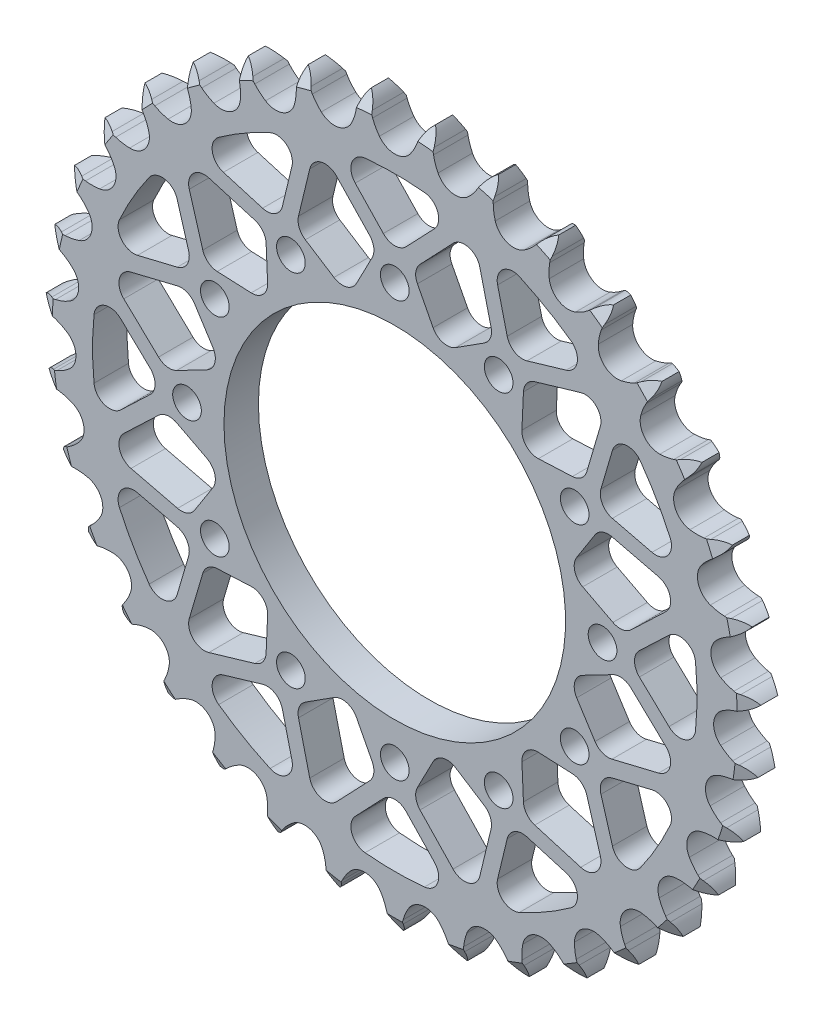
from build123d import *

# Parameters (mm, degrees)
EXTRUSION_DEPTH          = 7.2136
CUT_EXTRUDE_DEPTH        = 107.101930402
CUT_EXTRUDE_DEPTH_BACK   = 107.101930402
SKETCH1_R                = 35.764294032
F_6_0MM_DOWEL_HOLE1_D    = 6
CIRPATTERN1_COUNT        = 12
CUT_EXTRUDE2_DEPTH       = 107.101930402
FILLET2_R                = 3.302
CIRPATTERN3_COUNT        = 12
FILLET2_OF_CIRPATTERN3_R = 3.302


with BuildPart() as part:
    # Teeth Sketch → Extrusion (new body)
    with BuildSketch(Plane.XY):
        with BuildLine():
            ThreePointArc((6.71304247, 74.58801073), (5.721364967, 73.433815654), (5.028178681, 72.079163184))
            Line((5.028178681, 72.079163184), (4.640959349, 71.033174889))
            ThreePointArc((4.640959349, 71.033174889), (4.020032266, 69.686911282), (3.213588317, 68.442875791))
            ThreePointArc((3.213588317, 68.442875791), (0, 66.830622976), (-3.213588317, 68.442875791))
            ThreePointArc((-3.213588317, 68.442875791), (-4.020032266, 69.686911282), (-4.640959349, 71.033174889))
            Line((-4.640959349, 71.033174889), (-5.028178681, 72.079163184))
            ThreePointArc((-5.028178681, 72.079163184), (-5.721364967, 73.433815654), (-6.71304247, 74.58801073))
            ThreePointArc((-6.71304247, 74.58801073), (-7.482693818, 73.275293188), (-7.922857777, 71.81863735))
            Line((-7.922857777, 71.81863735), (-8.117085913, 70.720317836))
            ThreePointArc((-8.117085913, 70.720317836), (-8.487649793, 69.284818426), (-9.059002741, 67.91677897))
            ThreePointArc((-9.059002741, 67.91677897), (-11.933068516, 65.75662737), (-15.382892003, 66.769162268))
            ThreePointArc((-15.382892003, 66.769162268), (-16.39850718, 67.84920947), (-17.249840359, 69.062967255))
            Line((-17.249840359, 69.062967255), (-17.817605339, 70.023005406))
            ThreePointArc((-17.817605339, 70.023005406), (-18.741534375, 71.232114863), (-19.923364701, 72.190690694))
            ThreePointArc((-19.923364701, 72.190690694), (-20.446252667, 70.761642508), (-20.619247067, 69.249801418))
            Line((-20.619247067, 69.249801418), (-20.614241355, 68.134451579))
            ThreePointArc((-20.614241355, 68.134451579), (-20.722531804, 66.655854499), (-21.040429998, 65.207780992))
            ThreePointArc((-21.040429998, 65.207780992), (-23.482598391, 62.569159656), (-27.057776883, 62.949432932))
            ThreePointArc((-27.057776883, 62.949432932), (-28.249920581, 63.830778239), (-29.304297307, 64.873019029))
            Line((-29.304297307, 64.873019029), (-30.034359501, 65.716250619))
            ThreePointArc((-30.034359501, 65.716250619), (-31.159335447, 66.740955291), (-32.493333597, 67.473102461))
            ThreePointArc((-32.493333597, 67.473102461), (-32.752652133, 65.973654415), (-32.65291679, 64.455219891))
            Line((-32.65291679, 64.455219891), (-32.448838118, 63.358687986))
            ThreePointArc((-32.448838118, 63.358687986), (-32.291374592, 61.884516564), (-32.345600523, 60.402951279))
            ThreePointArc((-32.345600523, 60.402951279), (-34.277378233, 57.370667669), (-37.863002551, 57.106457027))
            ThreePointArc((-37.863002551, 57.106457027), (-39.19335829, 57.760773275), (-40.416890027, 58.597998593))
            Line((-40.416890027, 58.597998593), (-41.285784636, 59.297321467))
            ThreePointArc((-41.285784636, 59.297321467), (-42.57564984, 60.104686501), (-44.018940016, 60.586873197))
            ThreePointArc((-44.018940016, 60.586873197), (-44.006354409, 59.065218786), (-43.637094901, 57.588994562))
            Line((-43.637094901, 57.588994562), (-43.240502525, 56.54652403))
            ThreePointArc((-43.240502525, 56.54652403), (-42.822346032, 55.124159347), (-42.611156832, 53.656721012))
            ThreePointArc((-42.611156832, 53.656721012), (-43.970454934, 50.328235218), (-47.451280163, 49.428032606))
            ThreePointArc((-47.451280163, 49.428032606), (-48.877089215, 49.834289533), (-50.230450647, 50.439590267))
            Line((-50.230450647, 50.439590267), (-51.210250682, 50.972527612))
            ThreePointArc((-51.210250682, 50.972527612), (-52.623547816, 51.536603632), (-54.129741484, 51.753331977))
            ThreePointArc((-54.129741484, 51.753331977), (-53.845656247, 50.258378426), (-53.218740877, 48.871811564))
            Line((-53.218740877, 48.871811564), (-52.642381603, 47.916908265))
            ThreePointArc((-52.642381603, 47.916908265), (-51.976972035, 46.592066293), (-51.507155501, 45.185919584))
            ThreePointArc((-51.507155501, 45.185919584), (-52.250285035, 41.668211877), (-55.514434587, 40.160950547))
            ThreePointArc((-55.514434587, 40.160950547), (-56.989870277, 40.306090721), (-58.429563253, 40.660012009))
            Line((-58.429563253, 40.660012009), (-59.488777136, 41.009434779))
            ThreePointArc((-59.488777136, 41.009434779), (-60.980081666, 41.312091918), (-62.500768523, 41.256396085))
            ThreePointArc((-62.500768523, 41.256396085), (-61.954314388, 39.83619243), (-61.089892733, 38.58384833))
            Line((-61.089892733, 38.58384833), (-60.352291222, 37.747203643))
            ThreePointArc((-60.352291222, 37.747203643), (-59.461015391, 36.562465892), (-58.747671811, 35.26280552))
            ThreePointArc((-58.747671811, 35.26280552), (-58.850747983, 31.668937922), (-61.793309406, 29.603062493))
            ThreePointArc((-61.793309406, 29.603062493), (-63.270950016, 29.48242099), (-64.750701621, 29.573587509))
            Line((-64.750701621, 29.573587509), (-65.855285346, 29.72826497))
            ThreePointArc((-65.855285346, 29.72826497), (-67.376665517, 29.759775578), (-68.862969436, 29.433445677))
            ThreePointArc((-68.862969436, 29.433445677), (-68.071709889, 28.133638433), (-66.997565172, 27.055768464))
            Line((-66.997565172, 27.055768464), (-66.122428543, 26.364272836))
            ThreePointArc((-66.122428543, 26.364272836), (-65.033932787, 25.357717754), (-64.099989612, 24.206315873))
            ThreePointArc((-64.099989612, 24.206315873), (-63.559699469, 20.651798244), (-66.086096418, 18.093707653))
            ThreePointArc((-66.086096418, 18.093707653), (-67.518449363, 17.71116199), (-68.990699161, 17.536643574))
            Line((-68.990699161, 17.536643574), (-70.105150498, 17.491604264))
            ThreePointArc((-70.105150498, 17.491604264), (-71.6077079, 17.250955565), (-73.01185785, 16.664480107))
            ThreePointArc((-73.01185785, 16.664480107), (-72.001224624, 15.526846148), (-70.75188074, 14.658093938))
            Line((-70.75188074, 14.658093938), (-69.767336604, 14.133972608))
            ThreePointArc((-69.767336604, 14.133972608), (-68.516606073, 13.337951702), (-67.392081005, 12.371815317))
            ThreePointArc((-67.392081005, 12.371815317), (-66.225789916, 8.970892779), (-68.254821914, 6.002806162))
            ThreePointArc((-68.254821914, 6.002806162), (-69.595850193, 5.37065167), (-71.013278864, 4.936057485))
            Line((-71.013278864, 4.936057485), (-72.101778431, 4.692749005))
            ThreePointArc((-72.101778431, 4.692749005), (-73.537219633, 4.187675646), (-74.814085078, 3.359904435))
            ThreePointArc((-74.814085078, 3.359904435), (-73.616560757, 2.421008252), (-72.232172646, 1.789296212))
            Line((-72.232172646, 1.789296212), (-71.169865063, 1.449394871))
            ThreePointArc((-71.169865063, 1.449394871), (-69.797099265, 0.889492908), (-68.518135464, 0.139674437))
            ThreePointArc((-68.518135464, 0.139674437), (-66.763328985, -2.998344562), (-68.229781274, -6.281030459))
            ThreePointArc((-68.229781274, -6.281030459), (-69.436383134, -7.142475813), (-70.753433355, -7.823177553))
            Line((-70.753433355, -7.823177553), (-71.780995879, -8.256935068))
            ThreePointArc((-71.780995879, -8.256935068), (-73.10318462, -9.010199614), (-74.211726055, -10.05266133))
            ThreePointArc((-74.211726055, -10.05266133), (-72.865800055, -10.762642841), (-71.390863091, -11.137010967))
            Line((-71.390863091, -11.137010967), (-70.284935499, -11.281767609))
            ThreePointArc((-70.284935499, -11.281767609), (-68.834256257, -11.587554919), (-67.441960672, -12.096955695))
            ThreePointArc((-67.441960672, -12.096955695), (-65.155039727, -14.871212641), (-66.011779325, -18.362989592))
            ThreePointArc((-66.011779325, -18.362989592), (-67.045173588, -19.426038247), (-68.219514282, -20.330969227))
            Line((-68.219514282, -20.330969227), (-69.153113058, -20.941234454))
            ThreePointArc((-69.153113058, -20.941234454), (-70.319553103, -21.918479645), (-71.224141095, -23.142126289))
            ThreePointArc((-71.224141095, -23.142126289), (-69.773072586, -23.600373738), (-68.254992455, -23.705365449))
            Line((-68.254992455, -23.705365449), (-67.140990279, -23.650324796))
            ThreePointArc((-67.140990279, -23.650324796), (-65.659023615, -23.692169198), (-64.198145773, -23.944779717))
            ThreePointArc((-64.198145773, -23.944779717), (-61.452613883, -26.26610771), (-61.672104473, -29.854747131))
            ThreePointArc((-61.672104473, -29.854747131), (-62.499076998, -31.085231827), (-63.492963888, -32.185306822))
            Line((-63.492963888, -32.185306822), (-64.302592284, -32.952465334))
            ThreePointArc((-64.302592284, -32.952465334), (-65.275793291, -34.122281706), (-65.947353637, -35.487784268))
            ThreePointArc((-65.947353637, -35.487784268), (-64.437781154, -35.679569204), (-62.925350201, -35.511809981))
            Line((-62.925350201, -35.511809981), (-61.839078386, -35.258741085))
            ThreePointArc((-61.839078386, -35.258741085), (-60.373455931, -35.035297664), (-58.890949646, -35.022998817))
            ThreePointArc((-58.890949646, -35.022998817), (-55.775050465, -36.816788466), (-55.350237439, -40.386948533))
            ThreePointArc((-55.350237439, -40.386948533), (-55.94420865, -41.74532048), (-56.725697393, -43.005182174))
            Line((-56.725697393, -43.005182174), (-57.385333286, -43.904576866))
            ThreePointArc((-57.385333286, -43.904576866), (-58.134015774, -45.229365557), (-58.550963971, -46.69283566))
            ThreePointArc((-58.550963971, -46.69283566), (-57.031406416, -46.611993959), (-55.573235417, -46.176875721))
            Line((-55.573235417, -46.176875721), (-54.549607633, -45.733912424))
            ThreePointArc((-54.549607633, -45.733912424), (-53.147435697, -45.252362836), (-51.690949942, -44.975549918))
            ThreePointArc((-51.690949942, -44.975549918), (-48.304831033, -46.184147347), (-47.249368232, -49.621080178))
            ThreePointArc((-47.249368232, -49.621080178), (-47.591247404, -51.063680184), (-48.13522031, -52.442835586))
            Line((-48.13522031, -52.442835586), (-48.623662459, -53.445559171))
            ThreePointArc((-48.623662459, -53.445559171), (-49.123763156, -54.882740383), (-49.272698147, -56.397140896))
            ThreePointArc((-49.272698147, -56.397140896), (-47.79199535, -56.046270876), (-46.434951121, -55.357778681))
            Line((-46.434951121, -55.357778681), (-45.506867607, -54.739158188))
            ThreePointArc((-45.506867607, -54.739158188), (-44.21321315, -54.014979833), (-42.829560576, -53.482549839))
            ThreePointArc((-42.829560576, -53.482549839), (-39.282054587, -54.067109732), (-37.629865453, -57.260349478))
            ThreePointArc((-37.629865453, -57.260349478), (-37.708664308, -58.740811192), (-37.99763764, -60.194933112))
            Line((-37.99763764, -60.194933112), (-38.299187113, -61.26875723))
            ThreePointArc((-38.299187113, -61.26875723), (-38.534632372, -62.772138777), (-38.410767263, -64.288795619))
            ThreePointArc((-38.410767263, -64.288795619), (-37.016510231, -63.679174531), (-35.804209288, -62.759437086))
            Line((-35.804209288, -62.759437086), (-35.001499413, -61.985042368))
            ThreePointArc((-35.001499413, -61.985042368), (-33.857941554, -61.041510934), (-32.591593892, -60.270576602))
            ThreePointArc((-32.591593892, -60.270576602), (-28.996720584, -60.212310724), (-26.800907836, -63.059224032))
            ThreePointArc((-26.800907836, -63.059224032), (-26.614093715, -64.529964196), (-26.638779631, -66.012315959))
            Line((-26.638779631, -66.012315959), (-26.743744381, -67.12272702))
            ThreePointArc((-26.743744381, -67.12272702), (-26.706966797, -68.643988981), (-26.314282715, -70.114155555))
            ThreePointArc((-26.314282715, -70.114155555), (-25.051284015, -69.265377122), (-24.02269071, -68.143955544))
            Line((-24.02269071, -68.143955544), (-23.371154229, -67.238676285))
            ThreePointArc((-23.371154229, -67.238676285), (-22.414447858, -66.106117649), (-21.306106564, -65.121457443))
            ThreePointArc((-21.306106564, -65.121457443), (-17.779408124, -64.422238506), (-15.110546989, -66.83132324))
            ThreePointArc((-15.110546989, -66.83132324), (-14.664124252, -68.245071055), (-14.423729327, -69.708008656))
            Line((-14.423729327, -69.708008656), (-14.328735699, -70.819317134))
            ThreePointArc((-14.328735699, -70.819317134), (-14.020917334, -72.309564898), (-13.372035469, -73.68598884))
            ThreePointArc((-13.372035469, -73.68598884), (-12.280888919, -72.6253335), (-11.469063086, -71.338271201))
            Line((-11.469063086, -71.338271201), (-10.989640918, -70.331203822))
            ThreePointArc((-10.989640918, -70.331203822), (-10.250535365, -69.04601935), (-9.335823441, -67.879281059))
            ThreePointArc((-9.335823441, -67.879281059), (-5.990650857, -66.561582535), (-2.93452073, -68.455408731))
            ThreePointArc((-2.93452073, -68.455408731), (-2.242837769, -69.766725179), (-1.745088495, -71.163228599))
            Line((-1.745088495, -71.163228599), (-1.453189662, -72.239716126))
            ThreePointArc((-1.453189662, -72.239716126), (-0.884224052, -73.651051903), (0, -74.889493815))
            ThreePointArc((0, -74.889493815), (0.884224052, -73.651051903), (1.453189662, -72.239716126))
            Line((1.453189662, -72.239716126), (1.745088495, -71.163228599))
            ThreePointArc((1.745088495, -71.163228599), (2.242837769, -69.766725179), (2.93452073, -68.455408731))
            ThreePointArc((2.93452073, -68.455408731), (5.990650857, -66.561582535), (9.335823441, -67.879281059))
            ThreePointArc((9.335823441, -67.879281059), (10.250535365, -69.04601935), (10.989640918, -70.331203822))
            Line((10.989640918, -70.331203822), (11.469063086, -71.338271201))
            ThreePointArc((11.469063086, -71.338271201), (12.280888919, -72.6253335), (13.372035469, -73.68598884))
            ThreePointArc((13.372035469, -73.68598884), (14.020917334, -72.309564898), (14.328735699, -70.819317134))
            Line((14.328735699, -70.819317134), (14.423729327, -69.708008656))
            ThreePointArc((14.423729327, -69.708008656), (14.664124252, -68.245071055), (15.110546989, -66.83132324))
            ThreePointArc((15.110546989, -66.83132324), (17.779408124, -64.422238506), (21.306106564, -65.121457443))
            ThreePointArc((21.306106564, -65.121457443), (22.414447858, -66.106117649), (23.371154229, -67.238676285))
            Line((23.371154229, -67.238676285), (24.02269071, -68.143955544))
            ThreePointArc((24.02269071, -68.143955544), (25.051284015, -69.265377122), (26.314282715, -70.114155555))
            ThreePointArc((26.314282715, -70.114155555), (26.706966797, -68.643988981), (26.743744381, -67.12272702))
            Line((26.743744381, -67.12272702), (26.638779631, -66.012315959))
            ThreePointArc((26.638779631, -66.012315959), (26.614093715, -64.529964196), (26.800907836, -63.059224032))
            ThreePointArc((26.800907836, -63.059224032), (28.996720584, -60.212310724), (32.591593892, -60.270576602))
            ThreePointArc((32.591593892, -60.270576602), (33.857941554, -61.041510934), (35.001499413, -61.985042368))
            Line((35.001499413, -61.985042368), (35.804209288, -62.759437086))
            ThreePointArc((35.804209288, -62.759437086), (37.016510231, -63.679174531), (38.410767263, -64.288795619))
            ThreePointArc((38.410767263, -64.288795619), (38.534632372, -62.772138777), (38.299187113, -61.26875723))
            Line((38.299187113, -61.26875723), (37.99763764, -60.194933112))
            ThreePointArc((37.99763764, -60.194933112), (37.708664308, -58.740811192), (37.629865453, -57.260349478))
            ThreePointArc((37.629865453, -57.260349478), (39.282054587, -54.067109732), (42.829560576, -53.482549839))
            ThreePointArc((42.829560576, -53.482549839), (44.21321315, -54.014979833), (45.506867607, -54.739158188))
            Line((45.506867607, -54.739158188), (46.434951121, -55.357778681))
            ThreePointArc((46.434951121, -55.357778681), (47.79199535, -56.046270876), (49.272698147, -56.397140896))
            ThreePointArc((49.272698147, -56.397140896), (49.123763156, -54.882740383), (48.623662459, -53.445559171))
            Line((48.623662459, -53.445559171), (48.13522031, -52.442835586))
            ThreePointArc((48.13522031, -52.442835586), (47.591247404, -51.063680184), (47.249368232, -49.621080178))
            ThreePointArc((47.249368232, -49.621080178), (48.304831033, -46.184147347), (51.690949942, -44.975549918))
            ThreePointArc((51.690949942, -44.975549918), (53.147435697, -45.252362836), (54.549607633, -45.733912424))
            Line((54.549607633, -45.733912424), (55.573235417, -46.176875721))
            ThreePointArc((55.573235417, -46.176875721), (57.031406416, -46.611993959), (58.550963971, -46.69283566))
            ThreePointArc((58.550963971, -46.69283566), (58.134015774, -45.229365557), (57.385333286, -43.904576866))
            Line((57.385333286, -43.904576866), (56.725697393, -43.005182174))
            ThreePointArc((56.725697393, -43.005182174), (55.94420865, -41.74532048), (55.350237439, -40.386948533))
            ThreePointArc((55.350237439, -40.386948533), (55.775050465, -36.816788466), (58.890949646, -35.022998817))
            ThreePointArc((58.890949646, -35.022998817), (60.373455931, -35.035297664), (61.839078386, -35.258741085))
            Line((61.839078386, -35.258741085), (62.925350201, -35.511809981))
            ThreePointArc((62.925350201, -35.511809981), (64.437781154, -35.679569204), (65.947353637, -35.487784268))
            ThreePointArc((65.947353637, -35.487784268), (65.275793291, -34.122281706), (64.302592284, -32.952465334))
            Line((64.302592284, -32.952465334), (63.492963888, -32.185306822))
            ThreePointArc((63.492963888, -32.185306822), (62.499076998, -31.085231827), (61.672104473, -29.854747131))
            ThreePointArc((61.672104473, -29.854747131), (61.452613883, -26.26610771), (64.198145773, -23.944779717))
            ThreePointArc((64.198145773, -23.944779717), (65.659023615, -23.692169198), (67.140990279, -23.650324796))
            Line((67.140990279, -23.650324796), (68.254992455, -23.705365449))
            ThreePointArc((68.254992455, -23.705365449), (69.773072586, -23.600373738), (71.224141095, -23.142126289))
            ThreePointArc((71.224141095, -23.142126289), (70.319553103, -21.918479645), (69.153113058, -20.941234454))
            Line((69.153113058, -20.941234454), (68.219514282, -20.330969227))
            ThreePointArc((68.219514282, -20.330969227), (67.045173588, -19.426038247), (66.011779325, -18.362989592))
            ThreePointArc((66.011779325, -18.362989592), (65.155039727, -14.871212641), (67.441960672, -12.096955695))
            ThreePointArc((67.441960672, -12.096955695), (68.834256257, -11.587554919), (70.284935499, -11.281767609))
            Line((70.284935499, -11.281767609), (71.390863091, -11.137010967))
            ThreePointArc((71.390863091, -11.137010967), (72.865800055, -10.762642841), (74.211726055, -10.05266133))
            ThreePointArc((74.211726055, -10.05266133), (73.10318462, -9.010199614), (71.780995879, -8.256935068))
            Line((71.780995879, -8.256935068), (70.753433355, -7.823177553))
            ThreePointArc((70.753433355, -7.823177553), (69.436383134, -7.142475813), (68.229781274, -6.281030459))
            ThreePointArc((68.229781274, -6.281030459), (66.763328985, -2.998344562), (68.518135464, 0.139674437))
            ThreePointArc((68.518135464, 0.139674437), (69.797099265, 0.889492908), (71.169865063, 1.449394871))
            Line((71.169865063, 1.449394871), (72.232172646, 1.789296212))
            ThreePointArc((72.232172646, 1.789296212), (73.616560757, 2.421008252), (74.814085078, 3.359904435))
            ThreePointArc((74.814085078, 3.359904435), (73.537219633, 4.187675646), (72.101778431, 4.692749005))
            Line((72.101778431, 4.692749005), (71.013278864, 4.936057485))
            ThreePointArc((71.013278864, 4.936057485), (69.595850193, 5.37065167), (68.254821914, 6.002806162))
            ThreePointArc((68.254821914, 6.002806162), (66.225789916, 8.970892779), (67.392081005, 12.371815317))
            ThreePointArc((67.392081005, 12.371815317), (68.516606073, 13.337951702), (69.767336604, 14.133972608))
            Line((69.767336604, 14.133972608), (70.75188074, 14.658093938))
            ThreePointArc((70.75188074, 14.658093938), (72.001224624, 15.526846148), (73.01185785, 16.664480107))
            ThreePointArc((73.01185785, 16.664480107), (71.6077079, 17.250955565), (70.105150498, 17.491604264))
            Line((70.105150498, 17.491604264), (68.990699161, 17.536643574))
            ThreePointArc((68.990699161, 17.536643574), (67.518449363, 17.71116199), (66.086096418, 18.093707653))
            ThreePointArc((66.086096418, 18.093707653), (63.559699469, 20.651798244), (64.099989612, 24.206315873))
            ThreePointArc((64.099989612, 24.206315873), (65.033932787, 25.357717754), (66.122428543, 26.364272836))
            Line((66.122428543, 26.364272836), (66.997565172, 27.055768464))
            ThreePointArc((66.997565172, 27.055768464), (68.071709889, 28.133638433), (68.862969436, 29.433445677))
            ThreePointArc((68.862969436, 29.433445677), (67.376665517, 29.759775578), (65.855285346, 29.72826497))
            Line((65.855285346, 29.72826497), (64.750701621, 29.573587509))
            ThreePointArc((64.750701621, 29.573587509), (63.270950016, 29.48242099), (61.793309406, 29.603062493))
            ThreePointArc((61.793309406, 29.603062493), (58.850747983, 31.668937922), (58.747671811, 35.26280552))
            ThreePointArc((58.747671811, 35.26280552), (59.461015391, 36.562465892), (60.352291222, 37.747203643))
            Line((60.352291222, 37.747203643), (61.089892733, 38.58384833))
            ThreePointArc((61.089892733, 38.58384833), (61.954314388, 39.83619243), (62.500768523, 41.256396085))
            ThreePointArc((62.500768523, 41.256396085), (60.980081666, 41.312091918), (59.488777136, 41.009434779))
            Line((59.488777136, 41.009434779), (58.429563253, 40.660012009))
            ThreePointArc((58.429563253, 40.660012009), (56.989870277, 40.306090721), (55.514434587, 40.160950547))
            ThreePointArc((55.514434587, 40.160950547), (52.250285035, 41.668211877), (51.507155501, 45.185919584))
            ThreePointArc((51.507155501, 45.185919584), (51.976972035, 46.592066293), (52.642381603, 47.916908265))
            Line((52.642381603, 47.916908265), (53.218740877, 48.871811564))
            ThreePointArc((53.218740877, 48.871811564), (53.845656247, 50.258378426), (54.129741484, 51.753331977))
            ThreePointArc((54.129741484, 51.753331977), (52.623547816, 51.536603632), (51.210250682, 50.972527612))
            Line((51.210250682, 50.972527612), (50.230450647, 50.439590267))
            ThreePointArc((50.230450647, 50.439590267), (48.877089215, 49.834289533), (47.451280163, 49.428032606))
            ThreePointArc((47.451280163, 49.428032606), (43.970454934, 50.328235218), (42.611156832, 53.656721012))
            ThreePointArc((42.611156832, 53.656721012), (42.822346032, 55.124159347), (43.240502525, 56.54652403))
            Line((43.240502525, 56.54652403), (43.637094901, 57.588994562))
            ThreePointArc((43.637094901, 57.588994562), (44.006354409, 59.065218786), (44.018940016, 60.586873197))
            ThreePointArc((44.018940016, 60.586873197), (42.57564984, 60.104686501), (41.285784636, 59.297321467))
            Line((41.285784636, 59.297321467), (40.416890027, 58.597998593))
            ThreePointArc((40.416890027, 58.597998593), (39.19335829, 57.760773275), (37.863002551, 57.106457027))
            ThreePointArc((37.863002551, 57.106457027), (34.277378233, 57.370667669), (32.345600523, 60.402951279))
            ThreePointArc((32.345600523, 60.402951279), (32.291374592, 61.884516564), (32.448838118, 63.358687986))
            Line((32.448838118, 63.358687986), (32.65291679, 64.455219891))
            ThreePointArc((32.65291679, 64.455219891), (32.752652133, 65.973654415), (32.493333597, 67.473102461))
            ThreePointArc((32.493333597, 67.473102461), (31.159335447, 66.740955291), (30.034359501, 65.716250619))
            Line((30.034359501, 65.716250619), (29.304297307, 64.873019029))
            ThreePointArc((29.304297307, 64.873019029), (28.249920581, 63.830778239), (27.057776883, 62.949432932))
            ThreePointArc((27.057776883, 62.949432932), (23.482598391, 62.569159656), (21.040429998, 65.207780992))
            ThreePointArc((21.040429998, 65.207780992), (20.722531804, 66.655854499), (20.614241355, 68.134451579))
            Line((20.614241355, 68.134451579), (20.619247067, 69.249801418))
            ThreePointArc((20.619247067, 69.249801418), (20.446252667, 70.761642508), (19.923364701, 72.190690694))
            ThreePointArc((19.923364701, 72.190690694), (18.741534375, 71.232114863), (17.817605339, 70.023005406))
            Line((17.817605339, 70.023005406), (17.249840359, 69.062967255))
            ThreePointArc((17.249840359, 69.062967255), (16.39850718, 67.84920947), (15.382892003, 66.769162268))
            ThreePointArc((15.382892003, 66.769162268), (11.933068516, 65.75662737), (9.059002741, 67.91677897))
            ThreePointArc((9.059002741, 67.91677897), (8.487649793, 69.284818426), (8.117085913, 70.720317836))
            Line((8.117085913, 70.720317836), (7.922857777, 71.81863735))
            ThreePointArc((7.922857777, 71.81863735), (7.482693818, 73.275293188), (6.71304247, 74.58801073))
        make_face()
    extrude(amount=EXTRUSION_DEPTH)

    # Sketch1 → Cut-Extrude (cut, two sides: drawn at the far end of the back side and taken through both)
    with BuildSketch(Plane(origin=(0, 0, 0), x_dir=(-1, 0, 0), z_dir=(0, 0, -1)).offset(-CUT_EXTRUDE_DEPTH_BACK)):
        Circle(SKETCH1_R)
    extrude(amount=CUT_EXTRUDE_DEPTH + CUT_EXTRUDE_DEPTH_BACK, mode=Mode.SUBTRACT)

    # Ø6.0mm Dowel Hole1 (through all)
    with Locations(Plane.XY.offset(7.2136)):
        with Locations((-43.500000122, 0)):
            f_6_0mm_dowel_hole1 = Hole(F_6_0MM_DOWEL_HOLE1_D / 2)

    # CirPattern1: Ø6.0mm Dowel Hole1 ×12 about axis
    cirpattern1_axis = Axis((0, 0, 7.2136), (0, 0, -1))
    for i in range(1, CIRPATTERN1_COUNT):
        add(f_6_0mm_dowel_hole1.rotate(cirpattern1_axis, i * 360 / CIRPATTERN1_COUNT), mode=Mode.SUBTRACT)

    # Sketch9 → Cut-Extrude2 (cut, through all)
    with BuildSketch(Plane.XY):
        with BuildLine():
            Line((-48.707000122, 0), (-61.996550726, 12.653284584))
            ThreePointArc((-61.996550726, 12.653284584), (-63.274622976, 0), (-61.996550726, -12.653284584))
            Line((-61.996550726, -12.653284584), (-48.707000122, 0))
        make_face()
        Polygon((-43.188712268, 20.712736659), (-61.118592481, 16.376677498), (-47.75889031, 3.656600005), (-36.140398804, 9.683790674), align=None)
    cut_extrude2 = extrude(amount=CUT_EXTRUDE2_DEPTH, mode=Mode.SUBTRACT)

    # Fillet2
    fillet2_edges = [part.edges().sort_by_distance(p)[0] for p in [
        (-61.118592481, 16.376677498, 3.6068),
        (-36.140398804, 9.683790674, 3.6068),
        (-47.75889031, 3.656600005, 3.6068),
        (-43.188712268, 20.712736659, 3.6068),
        (-61.996550726, -12.653284584, 3.6068),
        (-48.707000122, 0, 3.6068),
        (-61.996550726, 12.653284584, 3.6068),
    ]]
    fillet(fillet2_edges, radius=FILLET2_R)

    # CirPattern3: Cut-Extrude2 ×12 about axis
    cirpattern3_axis = Axis((0, 0, 7.2136), (0, 0, -1))
    for i in range(1, CIRPATTERN3_COUNT):
        add(cut_extrude2.rotate(cirpattern3_axis, i * 360 / CIRPATTERN3_COUNT), mode=Mode.SUBTRACT)

    # Fillet2 of CirPattern3
    fillet2_of_cirpattern3_edges = [part.edges().sort_by_distance(p)[0] for p in [
        (-44.741914983, 44.741914983, 3.6068),
        (-26.45660813, 26.45660813, 3.6068),
        (-39.532112263, 27.046153651, 3.6068),
        (-27.046153651, 39.532112263, 3.6068),
        (-60.017230168, 20.040209472, 3.6068),
        (-42.181499448, 24.353500061, 3.6068),
        (-47.363945584, 41.956341254, 3.6068),
        (-16.376677498, 61.118592481, 3.6068),
        (-9.683790674, 36.140398804, 3.6068),
        (-20.712736659, 43.188712268, 3.6068),
        (-3.656600005, 47.75889031, 3.6068),
        (-41.956341254, 47.363945584, 3.6068),
        (-24.353500061, 42.181499448, 3.6068),
        (-20.040209472, 60.017230168, 3.6068),
        (16.376677498, 61.118592481, 3.6068),
        (9.683790674, 36.140398804, 3.6068),
        (3.656600005, 47.75889031, 3.6068),
        (20.712736659, 43.188712268, 3.6068),
        (-12.653284584, 61.996550726, 3.6068),
        (0, 48.707000122, 3.6068),
        (12.653284584, 61.996550726, 3.6068),
        (44.741914983, 44.741914983, 3.6068),
        (26.45660813, 26.45660813, 3.6068),
        (27.046153651, 39.532112263, 3.6068),
        (39.532112263, 27.046153651, 3.6068),
        (20.040209472, 60.017230168, 3.6068),
        (24.353500061, 42.181499448, 3.6068),
        (41.956341254, 47.363945584, 3.6068),
        (61.118592481, 16.376677498, 3.6068),
        (36.140398804, 9.683790674, 3.6068),
        (43.188712268, 20.712736659, 3.6068),
        (47.75889031, 3.656600005, 3.6068),
        (47.363945584, 41.956341254, 3.6068),
        (42.181499448, 24.353500061, 3.6068),
        (60.017230168, 20.040209472, 3.6068),
        (61.118592481, -16.376677498, 3.6068),
        (36.140398804, -9.683790674, 3.6068),
        (47.75889031, -3.656600005, 3.6068),
        (43.188712268, -20.712736659, 3.6068),
        (61.996550726, 12.653284584, 3.6068),
        (48.707000122, 0, 3.6068),
        (61.996550726, -12.653284584, 3.6068),
        (44.741914983, -44.741914983, 3.6068),
        (26.45660813, -26.45660813, 3.6068),
        (39.532112263, -27.046153651, 3.6068),
        (27.046153651, -39.532112263, 3.6068),
        (60.017230168, -20.040209472, 3.6068),
        (42.181499448, -24.353500061, 3.6068),
        (47.363945584, -41.956341254, 3.6068),
        (16.376677498, -61.118592481, 3.6068),
        (9.683790674, -36.140398804, 3.6068),
        (20.712736659, -43.188712268, 3.6068),
        (3.656600005, -47.75889031, 3.6068),
        (41.956341254, -47.363945584, 3.6068),
        (24.353500061, -42.181499448, 3.6068),
        (20.040209472, -60.017230168, 3.6068),
        (-16.376677498, -61.118592481, 3.6068),
        (-9.683790674, -36.140398804, 3.6068),
        (-3.656600005, -47.75889031, 3.6068),
        (-20.712736659, -43.188712268, 3.6068),
        (12.653284584, -61.996550726, 3.6068),
        (0, -48.707000122, 3.6068),
        (-12.653284584, -61.996550726, 3.6068),
        (-44.741914983, -44.741914983, 3.6068),
        (-26.45660813, -26.45660813, 3.6068),
        (-27.046153651, -39.532112263, 3.6068),
        (-39.532112263, -27.046153651, 3.6068),
        (-20.040209472, -60.017230168, 3.6068),
        (-24.353500061, -42.181499448, 3.6068),
        (-41.956341254, -47.363945584, 3.6068),
        (-61.118592481, -16.376677498, 3.6068),
        (-36.140398804, -9.683790674, 3.6068),
        (-43.188712268, -20.712736659, 3.6068),
        (-47.75889031, -3.656600005, 3.6068),
        (-47.363945584, -41.956341254, 3.6068),
        (-42.181499448, -24.353500061, 3.6068),
        (-60.017230168, -20.040209472, 3.6068),
    ]]
    fillet(fillet2_of_cirpattern3_edges, radius=FILLET2_OF_CIRPATTERN3_R)

    # Sketch18 → Cut-Revolve2 (revolve, cut)
    with BuildSketch(Plane(origin=(0, 0, 0), x_dir=(0, 0, -1), z_dir=(1, 0, 0))):
        Polygon((-7.2136, -74.889493815), (-5.3848, -74.889493815), (-7.2136, -71.695911683), align=None)
    cut_revolve2 = revolve(axis=Axis((0, 0, -0.36068), (0, 0, 1)), mode=Mode.SUBTRACT)

    # Mirror1: Cut-Revolve2 across plane
    add(cut_revolve2.mirror(Plane(origin=(0, 0, 3.6068), x_dir=(1, 0, 0), z_dir=(0, 0, -1))), mode=Mode.SUBTRACT)


solid = part.part
